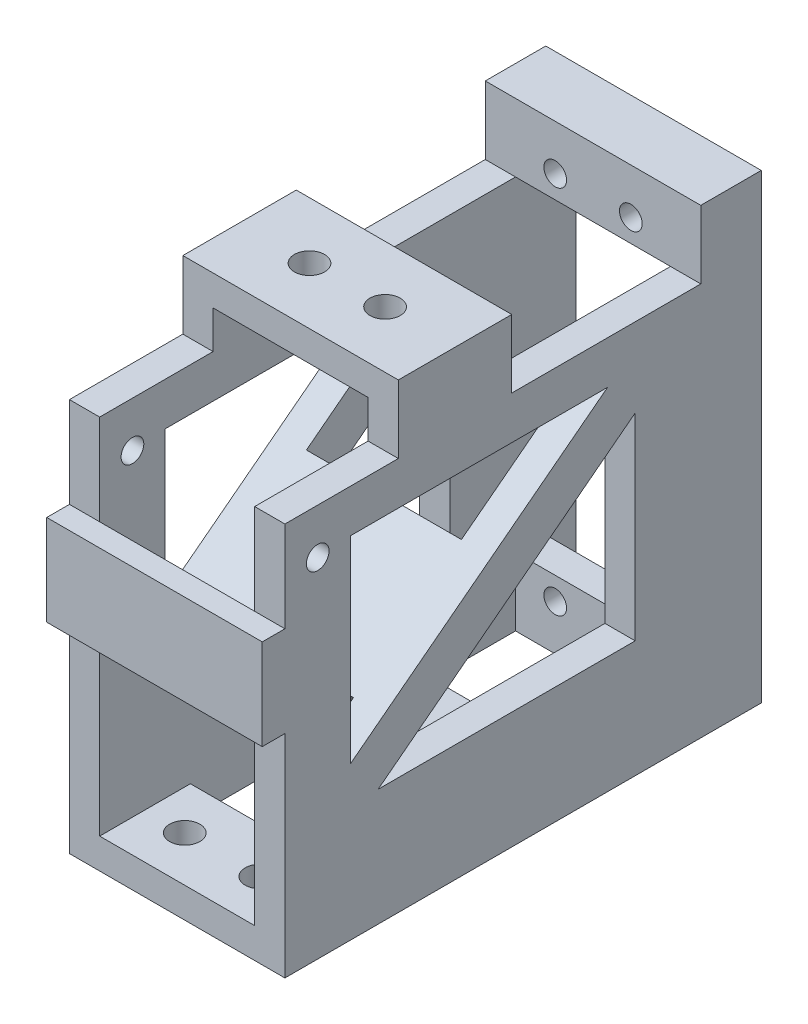
from build123d import *

# Parameters (mm, degrees)
SKETCH1_W                       = 28.5
SKETCH1_H                       = 61
SKETCH1_W_2                     = 20.5
SKETCH1_H_2                     = 43
BOSS_EXTRUDE1_DEPTH             = 8
SKETCH2_W                       = 4
SKETCH2_H                       = 52
BOSS_EXTRUDE2_DEPTH             = 55
SKETCH3_W                       = 28.5
SKETCH3_H                       = 12
BOSS_EXTRUDE3_DEPTH             = 4
CUT_EXTRUDE1_DEPTH              = 93.207646104
CUT_EXTRUDE1_DEPTH_BACK         = 93.207646104
SKETCH5_W                       = 15
SKETCH5_H                       = 5.682620757
BOSS_EXTRUDE4_DEPTH             = 20.5
CUT_EXTRUDE2_DEPTH              = 93.207646104
CUT_EXTRUDE2_DEPTH_BACK         = 4
SKETCH7_W                       = 20.5
SKETCH7_H                       = 7
F_3_0MM_DOWEL_HOLE1_D           = 3
F_3_0MM_DOWEL_HOLE1_DEPTH       = 4
F_3_0MM_DOWEL_HOLE1_CSINK_D     = 3.05
F_3_0MM_DOWEL_HOLE1_CSINK_ANGLE = 100
F_3_0MM_DOWEL_HOLE1_TIP         = 0.901290929
SKETCH19_R                      = 2
CUT_EXTRUDE3_DEPTH              = 4
SKETCH21_W                      = 28.5
SKETCH21_H                      = 15
BOSS_EXTRUDE5_DEPTH             = 9
SKETCH24_R                      = 2
CUT_EXTRUDE6_DEPTH              = 14.682620757
CUT_EXTRUDE7_START              = -15
CUT_EXTRUDE7_OUTLINE_W          = 20.5
CUT_EXTRUDE7_OUTLINE_H          = 5.682620757
CUT_EXTRUDE7_DEPTH              = 15
BOSS_EXTRUDE6_DEPTH             = 20.5
SKETCH27_W                      = 28.5
SKETCH27_H                      = 12
BOSS_EXTRUDE7_DEPTH             = 3
SKETCH28_W                      = 20.5
SKETCH28_H                      = 5
CUT_EXTRUDE8_DEPTH              = 15
CUT_EXTRUDE9_START              = -28.5
SKETCH29_R                      = 1.5
CUT_EXTRUDE9_DEPTH              = 28.5


# Read off the part's stored shape, not the designer's step: Cut-Extrude7
with BuildPart() as part:
    # Sketch1 → Boss-Extrude1 (new body)
    with BuildSketch(Plane.XY):
        with Locations((14.25, -30.5)):
            Rectangle(SKETCH1_W, SKETCH1_H)
        with Locations((14.25, -30.5)):
            Rectangle(SKETCH1_W_2, SKETCH1_H_2, mode=Mode.SUBTRACT)
    extrude(amount=BOSS_EXTRUDE1_DEPTH)

    # Sketch2 → Boss-Extrude2 (add)
    with BuildSketch(Plane.XY.offset(8)):
        with Locations((2, -35)):
            Rectangle(SKETCH2_W, SKETCH2_H)
        with Locations((26.5, -35)):
            Rectangle(SKETCH2_W, SKETCH2_H)
    extrude(amount=BOSS_EXTRUDE2_DEPTH)

    # Sketch3 → Boss-Extrude3 (add)
    with BuildSketch(Plane.XZ.offset(61)):
        with Locations((14.25, 57)):
            Rectangle(SKETCH3_W, SKETCH3_H)
        with Locations((14.25, 29)):
            Rectangle(SKETCH3_W, SKETCH3_H)
    extrude(amount=-BOSS_EXTRUDE3_DEPTH)

    # Sketch4 → Cut-Extrude1 (cut, two sides: drawn at the far end of the back side and taken through both)
    with BuildSketch(Plane(origin=(28.5, 0, 0), x_dir=(0, 0, -1), z_dir=(1, 0, 0)).offset(-CUT_EXTRUDE1_DEPTH_BACK)):
        Polygon((-54.327023097, -40.788512694), (-54.327023097, -14.682620757), (-20.327023097, -14.682620757), align=None)
        Polygon((-50.672976903, -45.547498554), (-16.672976903, -45.547498554), (-16.672976903, -19.441606616), align=None)
    extrude(amount=CUT_EXTRUDE1_DEPTH + CUT_EXTRUDE1_DEPTH_BACK, mode=Mode.SUBTRACT)

    # Sketch5 → Boss-Extrude4 (add)
    with BuildSketch(Plane(origin=(4, 0, 0), x_dir=(0, 0, -1), z_dir=(1, 0, 0))):
        with Locations((-30.827023097, -11.841310379)):
            Rectangle(SKETCH5_W, SKETCH5_H)
    extrude(amount=BOSS_EXTRUDE4_DEPTH)

    # Sketch7 → Cut-Extrude2 (cut, two sides: drawn at the far end of the back side and taken through both)
    with BuildSketch(Plane(origin=(0, 0, 0), x_dir=(-1, 0, 0), z_dir=(0, 0, -1)).offset(-CUT_EXTRUDE2_DEPTH_BACK)):
        with Locations((-14.25, -5.5)):
            Rectangle(SKETCH7_W, SKETCH7_H)
        with Locations((-14.25, -55.5)):
            Rectangle(SKETCH7_W, SKETCH7_H)
    extrude(amount=CUT_EXTRUDE2_DEPTH + CUT_EXTRUDE2_DEPTH_BACK, mode=Mode.SUBTRACT)

    # Ø3.0mm Dowel Hole1
    with Locations(Plane(origin=(0, 0, 4), x_dir=(-1, 0, 0), z_dir=(0, 0, -1))):
        with Locations((-19.25, -55), (-9.25, -55), (-19.25, -6), (-9.25, -6)):
            CounterSinkHole(F_3_0MM_DOWEL_HOLE1_D / 2, F_3_0MM_DOWEL_HOLE1_CSINK_D / 2, depth=F_3_0MM_DOWEL_HOLE1_DEPTH, counter_sink_angle=F_3_0MM_DOWEL_HOLE1_CSINK_ANGLE)
            with Locations((0, 0, -(F_3_0MM_DOWEL_HOLE1_DEPTH + F_3_0MM_DOWEL_HOLE1_TIP / 2))):  # 118° drill point
                Cone(0, F_3_0MM_DOWEL_HOLE1_D / 2, F_3_0MM_DOWEL_HOLE1_TIP, mode=Mode.SUBTRACT)

    # Sketch19 → Cut-Extrude3 (cut)
    with BuildSketch(Plane.XZ.offset(61)):
        with Locations(Location((9.25, 57, 0), (0, 0, 270))):
            Circle(SKETCH19_R)
        with Locations(Location((19.25, 57, 0), (0, 0, 270))):
            Circle(SKETCH19_R)
        with Locations(Location((9.25, 29, 0), (0, 0, 270))):
            Circle(SKETCH19_R)
        with Locations(Location((19.25, 29, 0), (0, 0, 270))):
            Circle(SKETCH19_R)
    extrude(amount=-CUT_EXTRUDE3_DEPTH, mode=Mode.SUBTRACT)

    # Sketch21 → Boss-Extrude5 (add)
    with BuildSketch(Plane(origin=(0, -9, 0), x_dir=(1, 0, 0), z_dir=(0, 1, 0))):
        with Locations((14.25, -40.5)):
            Rectangle(SKETCH21_W, SKETCH21_H)
    extrude(amount=BOSS_EXTRUDE5_DEPTH)

    # Sketch24 → Cut-Extrude6 (cut)
    with BuildSketch(Plane(origin=(0, 0, 0), x_dir=(1, 0, 0), z_dir=(0, 1, 0))):
        with Locations(Location((9.25, -40.5, 0), (0, 0, 180))):
            Circle(SKETCH24_R)
        with Locations(Location((19.25, -40.5, 0), (0, 0, 180))):
            Circle(SKETCH24_R)
    extrude(amount=-CUT_EXTRUDE6_DEPTH, mode=Mode.SUBTRACT)

    # Cut-Extrude7 outline → Cut-Extrude7 (cut)
    with BuildSketch(Plane.XY.offset(38.327023097).offset(CUT_EXTRUDE7_START)):
        with Locations((14.25, -11.841310379)):
            Rectangle(CUT_EXTRUDE7_OUTLINE_W, CUT_EXTRUDE7_OUTLINE_H)
    extrude(amount=CUT_EXTRUDE7_DEPTH, mode=Mode.SUBTRACT)

    # Sketch26 → Boss-Extrude6 (add)
    with BuildSketch(Plane(origin=(4, 0, 0), x_dir=(0, 0, -1), z_dir=(1, 0, 0))):
        Polygon((-46.276957579, -42.172145453), (-49.931003773, -37.413159593), (-35.654046194, -26.451021012), (-32, -31.210006872), align=None)
    extrude(amount=BOSS_EXTRUDE6_DEPTH)

    # Sketch27 → Boss-Extrude7 (add)
    with BuildSketch(Plane.XY.offset(63)):
        with Locations((14.25, -27)):
            Rectangle(SKETCH27_W, SKETCH27_H)
    extrude(amount=BOSS_EXTRUDE7_DEPTH)

    # Sketch28 → Cut-Extrude8 (cut)
    with BuildSketch(Plane.XY.offset(48)):
        with Locations((14.25, -6.5)):
            Rectangle(SKETCH28_W, SKETCH28_H)
    extrude(amount=-CUT_EXTRUDE8_DEPTH, mode=Mode.SUBTRACT)

    # Sketch29 → Cut-Extrude9 (cut)
    with BuildSketch(Plane(origin=(28.5, 0, 0), x_dir=(0, 0, -1), z_dir=(1, 0, 0)).offset(CUT_EXTRUDE9_START)):
        with Locations(Location((-58.663511548, -15, 0), (0, 0, 90))):
            Circle(SKETCH29_R)
    extrude(amount=CUT_EXTRUDE9_DEPTH, mode=Mode.SUBTRACT)


solid = part.part
